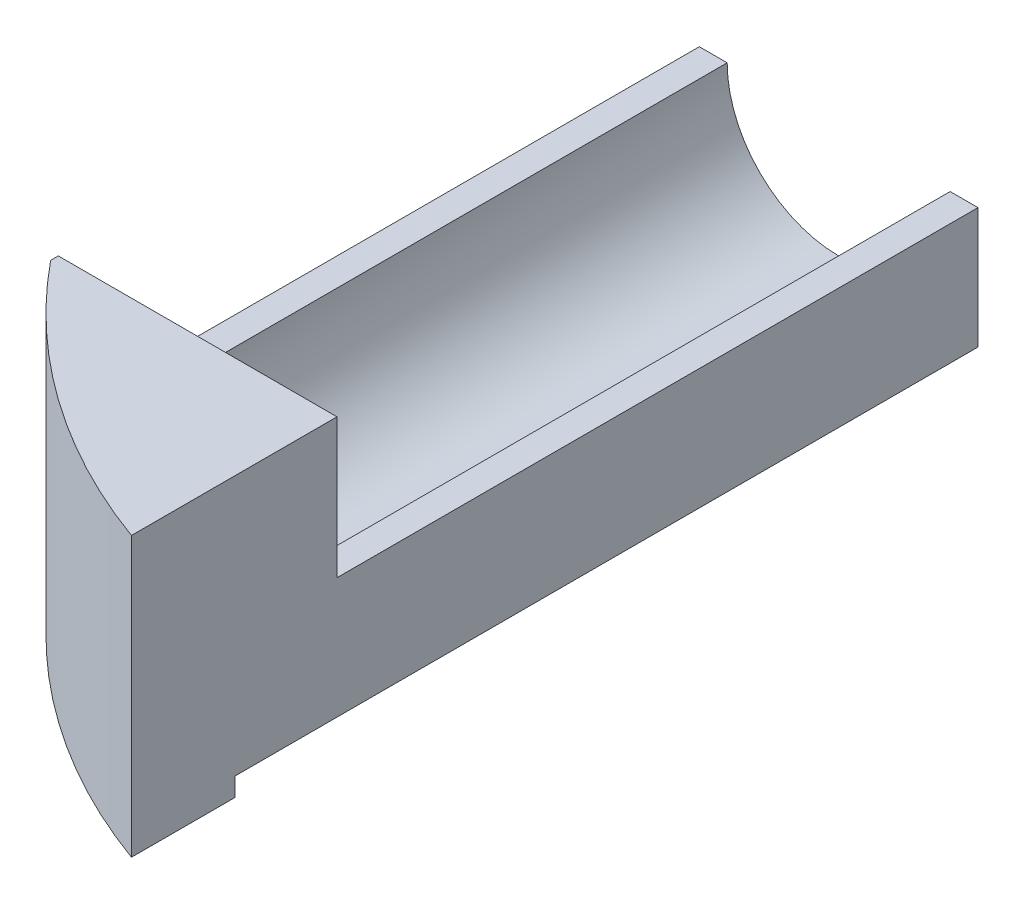
from build123d import *

# Parameters (mm, degrees)
SKETCH2_W           = 30
SKETCH2_H           = 30
BOSS_EXTRUDE1_DEPTH = 100
CUT_EXTRUDE1_START  = -30
CUT_EXTRUDE1_DEPTH  = 30
CUT_EXTRUDE2_DEPTH  = 69
CUT_EXTRUDE3_DEPTH  = 80
SKETCH6_R           = 12
CUT_EXTRUDE4_DEPTH  = 2


# Read off the part's stored shape, not the designer's step: Cut-Extrude1
with BuildPart() as part:
    # Sketch2 → Boss-Extrude1 (new body)
    with BuildSketch(Plane.XY):
        with Locations((-15, 15)):
            Rectangle(SKETCH2_W, SKETCH2_H)
    extrude(amount=BOSS_EXTRUDE1_DEPTH)

    # Cut-Extrude1 outline → Cut-Extrude1 (cut)
    with BuildSketch(Plane.XZ.offset(CUT_EXTRUDE1_START)):
        with BuildLine():
            ThreePointArc((-30, 69.824648593), (-16.445900415, 82.511221459), (0, 91.124879576))
            Line((0, 91.124879576), (0, 100))
            Line((0, 100), (-30, 100))
            Line((-30, 100), (-30, 69.824648593))
        make_face()
    extrude(amount=CUT_EXTRUDE1_DEPTH, mode=Mode.SUBTRACT)

    # Sketch4 → Cut-Extrude2 (cut)
    with BuildSketch(Plane(origin=(0, 0, 0), x_dir=(-1, 0, 0), z_dir=(0, 0, -1))):
        with BuildLine():
            Line((3, 15), (0, 15))
            Line((0, 15), (0, 30))
            Line((0, 30), (30, 30))
            Line((30, 30), (30, 15))
            Line((30, 15), (27, 15))
            ThreePointArc((27, 15), (15, 3), (3, 15))
        make_face()
    extrude(amount=-CUT_EXTRUDE2_DEPTH, mode=Mode.SUBTRACT)

    # Sketch5 → Cut-Extrude3 (cut)
    with BuildSketch(Plane(origin=(0, 0, 0), x_dir=(-1, 0, 0), z_dir=(0, 0, -1))):
        Polygon((0, 0), (0, 2), (2, 0), align=None)
    extrude(amount=-CUT_EXTRUDE3_DEPTH, mode=Mode.SUBTRACT)

    # Sketch6 → Cut-Extrude4 (cut)
    with BuildSketch(Plane(origin=(0, 0, 69), x_dir=(-1, 0, 0), z_dir=(0, 0, -1))):
        with Locations((15, 15)):
            Circle(SKETCH6_R)
    extrude(amount=-CUT_EXTRUDE4_DEPTH, mode=Mode.SUBTRACT)


solid = part.part
